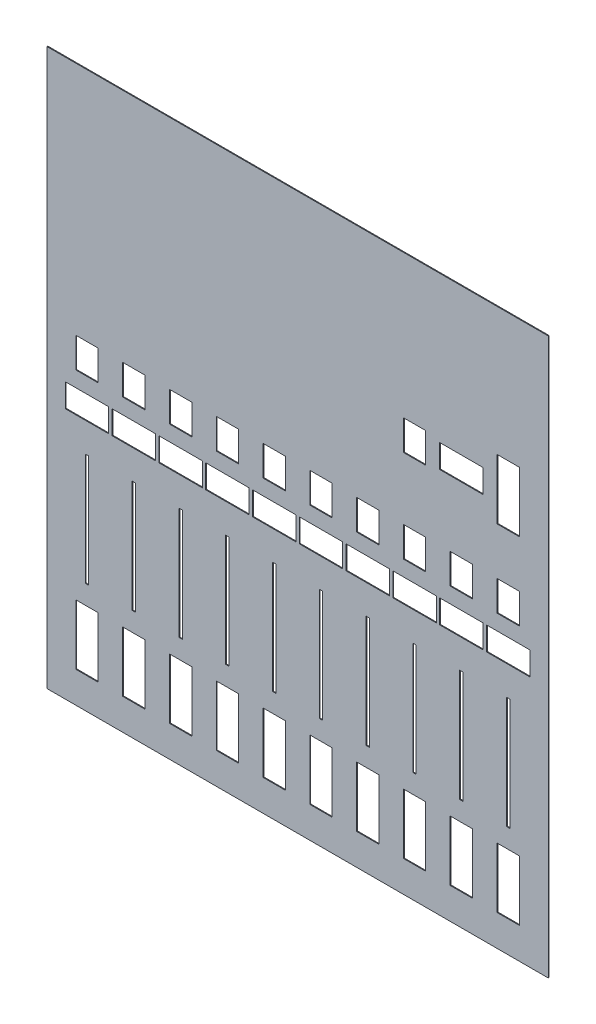
from build123d import *

# Parameters (mm, degrees)
SKETCH1_W           = 300
SKETCH1_H           = 210
SKETCH1_W_2         = 2
SKETCH1_H_2         = 67
SKETCH1_W_3         = 12.35
SKETCH1_H_3         = 17
SKETCH1_H_4         = 35
SKETCH1_W_4         = 25
SKETCH1_H_5         = 13
BOSS_EXTRUDE1_DEPTH = 0.5
SKETCH3_W           = 300
SKETCH3_H           = 66
SKETCH3_W_2         = 25
SKETCH3_H_2         = 13
SKETCH3_W_3         = 12.35
SKETCH3_H_3         = 35
BOSS_EXTRUDE2_DEPTH = 0.5
BOSS_EXTRUDE3_START = -300
BOSS_EXTRUDE3_DEPTH = 300
SKETCH13_W          = 12.35
SKETCH13_H          = 3.584384634
CUT_EXTRUDE4_DEPTH  = 15
SKETCH14_W          = 12.35
SKETCH14_H          = 17
CUT_EXTRUDE5_DEPTH  = 10
SKETCH15_W          = 12.35
SKETCH15_H          = 35
SKETCH15_W_2        = 13.35
SKETCH15_H_2        = 36
CUT_EXTRUDE6_DEPTH  = 10
SKETCH16_W          = 25
SKETCH16_H          = 13
CUT_EXTRUDE7_DEPTH  = 10
SKETCH17_W          = 12.35
SKETCH17_H          = 35
SKETCH17_H_2        = 17
CUT_EXTRUDE8_DEPTH  = 10
SKETCH18_W          = 13
SKETCH18_H          = 7
CUT_EXTRUDE9_DEPTH  = 10
SKETCH19_W          = 25
SKETCH19_H          = 1.257592029
BOSS_EXTRUDE7_DEPTH = 0.5
BOSS_EXTRUDE8_DEPTH = 0.5
SKETCH23_W          = 0.5
SKETCH23_H          = 56.7
BOSS_EXTRUDE9_DEPTH = 300
SKETCH24_W          = 145.58428362
SKETCH24_H          = 61.057685588
CUT_EXTRUDE11_DEPTH = 300


# Read off the part's stored shape, not the designer's step: Boss-Extrude3
with BuildPart() as part:
    # Sketch1 → Boss-Extrude1 (new body)
    with BuildSketch(Plane.XY):
        with Locations((140, 95)):
            Rectangle(SKETCH1_W, SKETCH1_H)
        with Locations((42, 89.5)):
            Rectangle(SKETCH1_W_2, SKETCH1_H_2, mode=Mode.SUBTRACT)
        with Locations((14.01, 172.725)):
            Rectangle(SKETCH1_W_3, SKETCH1_H_3, mode=Mode.SUBTRACT)
        with Locations((42.01, 172.725)):
            Rectangle(SKETCH1_W_3, SKETCH1_H_3, mode=Mode.SUBTRACT)
        with Locations((70.01, 172.725)):
            Rectangle(SKETCH1_W_3, SKETCH1_H_3, mode=Mode.SUBTRACT)
        with Locations((98.01, 172.725)):
            Rectangle(SKETCH1_W_3, SKETCH1_H_3, mode=Mode.SUBTRACT)
        with Locations((126.01, 172.725)):
            Rectangle(SKETCH1_W_3, SKETCH1_H_3, mode=Mode.SUBTRACT)
        with Locations((154.01, 172.725)):
            Rectangle(SKETCH1_W_3, SKETCH1_H_3, mode=Mode.SUBTRACT)
        with Locations((182.01, 172.725)):
            Rectangle(SKETCH1_W_3, SKETCH1_H_3, mode=Mode.SUBTRACT)
        with Locations((210.01, 172.725)):
            Rectangle(SKETCH1_W_3, SKETCH1_H_3, mode=Mode.SUBTRACT)
        with Locations((238.01, 172.725)):
            Rectangle(SKETCH1_W_3, SKETCH1_H_3, mode=Mode.SUBTRACT)
        with Locations((266.01, 172.725)):
            Rectangle(SKETCH1_W_3, SKETCH1_H_3, mode=Mode.SUBTRACT)
        with Locations((14.01, 26.625)):
            Rectangle(SKETCH1_W_3, SKETCH1_H_4, mode=Mode.SUBTRACT)
        with Locations((42.01, 26.625)):
            Rectangle(SKETCH1_W_3, SKETCH1_H_4, mode=Mode.SUBTRACT)
        with Locations((70.01, 26.625)):
            Rectangle(SKETCH1_W_3, SKETCH1_H_4, mode=Mode.SUBTRACT)
        with Locations((98.01, 26.625)):
            Rectangle(SKETCH1_W_3, SKETCH1_H_4, mode=Mode.SUBTRACT)
        with Locations((126.01, 26.625)):
            Rectangle(SKETCH1_W_3, SKETCH1_H_4, mode=Mode.SUBTRACT)
        with Locations((154.01, 26.625)):
            Rectangle(SKETCH1_W_3, SKETCH1_H_4, mode=Mode.SUBTRACT)
        with Locations((182.01, 26.625)):
            Rectangle(SKETCH1_W_3, SKETCH1_H_4, mode=Mode.SUBTRACT)
        with Locations((210.01, 26.625)):
            Rectangle(SKETCH1_W_3, SKETCH1_H_4, mode=Mode.SUBTRACT)
        with Locations((238.01, 26.625)):
            Rectangle(SKETCH1_W_3, SKETCH1_H_4, mode=Mode.SUBTRACT)
        with Locations((266.01, 26.625)):
            Rectangle(SKETCH1_W_3, SKETCH1_H_4, mode=Mode.SUBTRACT)
        with Locations((14, 89.5)):
            Rectangle(SKETCH1_W_2, SKETCH1_H_2, mode=Mode.SUBTRACT)
        with Locations((70, 89.5)):
            Rectangle(SKETCH1_W_2, SKETCH1_H_2, mode=Mode.SUBTRACT)
        with Locations((98, 89.5)):
            Rectangle(SKETCH1_W_2, SKETCH1_H_2, mode=Mode.SUBTRACT)
        with Locations((126, 89.5)):
            Rectangle(SKETCH1_W_2, SKETCH1_H_2, mode=Mode.SUBTRACT)
        with Locations((154, 89.5)):
            Rectangle(SKETCH1_W_2, SKETCH1_H_2, mode=Mode.SUBTRACT)
        with Locations((182, 89.5)):
            Rectangle(SKETCH1_W_2, SKETCH1_H_2, mode=Mode.SUBTRACT)
        with Locations((210, 89.5)):
            Rectangle(SKETCH1_W_2, SKETCH1_H_2, mode=Mode.SUBTRACT)
        with Locations((238, 89.5)):
            Rectangle(SKETCH1_W_2, SKETCH1_H_2, mode=Mode.SUBTRACT)
        with Locations((266, 89.5)):
            Rectangle(SKETCH1_W_2, SKETCH1_H_2, mode=Mode.SUBTRACT)
        with Locations((14, 147.5)):
            Rectangle(SKETCH1_W_4, SKETCH1_H_5, mode=Mode.SUBTRACT)
        with Locations((42, 147.5)):
            Rectangle(SKETCH1_W_4, SKETCH1_H_5, mode=Mode.SUBTRACT)
        with Locations((70, 147.5)):
            Rectangle(SKETCH1_W_4, SKETCH1_H_5, mode=Mode.SUBTRACT)
        with Locations((98, 147.5)):
            Rectangle(SKETCH1_W_4, SKETCH1_H_5, mode=Mode.SUBTRACT)
        with Locations((126, 147.5)):
            Rectangle(SKETCH1_W_4, SKETCH1_H_5, mode=Mode.SUBTRACT)
        with Locations((154, 147.5)):
            Rectangle(SKETCH1_W_4, SKETCH1_H_5, mode=Mode.SUBTRACT)
        with Locations((182, 147.5)):
            Rectangle(SKETCH1_W_4, SKETCH1_H_5, mode=Mode.SUBTRACT)
        with Locations((210, 147.5)):
            Rectangle(SKETCH1_W_4, SKETCH1_H_5, mode=Mode.SUBTRACT)
        with Locations((238, 147.5)):
            Rectangle(SKETCH1_W_4, SKETCH1_H_5, mode=Mode.SUBTRACT)
        with Locations((266, 147.5)):
            Rectangle(SKETCH1_W_4, SKETCH1_H_5, mode=Mode.SUBTRACT)
    extrude(amount=BOSS_EXTRUDE1_DEPTH)

    # Sketch3 → Boss-Extrude2 (add)
    with BuildSketch(Plane.XY.offset(0.5)):
        with Locations((140, 233)):
            Rectangle(SKETCH3_W, SKETCH3_H)
        with Locations((238, 229.85)):
            Rectangle(SKETCH3_W_2, SKETCH3_H_2, mode=Mode.SUBTRACT)
        with Locations((266, 228)):
            Rectangle(SKETCH3_W_3, SKETCH3_H_3, mode=Mode.SUBTRACT)
    extrude(amount=-BOSS_EXTRUDE2_DEPTH)

    # Boss-Extrude3 outline → Boss-Extrude3 (add)
    with BuildSketch(Plane(origin=(290, 0, 0), x_dir=(0, 0, -1), z_dir=(1, 0, 0)).offset(BOSS_EXTRUDE3_START)):
        with BuildLine():
            ThreePointArc((29.503906843, 296.000342244), (8.288157106, 287.214705752), (-0.5, 266))
            Line((-0.5, 266), (0, 266))
            ThreePointArc((0, 266), (8.331893478, 286.546702239), (28.621157433, 295.487238574))
            ThreePointArc((28.621157433, 295.487238574), (29.057049204, 295.497011647), (29.493037805, 295.500341552))
            ThreePointArc((29.493037805, 295.500341552), (29.496690131, 295.50034223), (29.500342456, 295.500342456))
            Line((29.500342456, 295.500342456), (29.501331505, 295.501324479))
            Line((29.501331505, 295.501324479), (29.752130896, 295.75034235))
            Line((29.752130896, 295.75034235), (29.503906843, 296.000342244))
        make_face()
        with BuildLine():
            ThreePointArc((29.855162644, 295.852642226), (29.694156025, 295.961264134), (29.503906843, 296.000342244))
            Line((29.503906843, 296.000342244), (29.752130896, 295.75034235))
            Line((29.752130896, 295.75034235), (29.855162644, 295.852642226))
        make_face()
        with BuildLine():
            ThreePointArc((29.912937624, 295.910006809), (29.713187706, 295.976752163), (29.503906843, 296.000342244))
            ThreePointArc((29.503906843, 296.000342244), (29.694156025, 295.961264134), (29.855162644, 295.852642226))
            Line((29.855162644, 295.852642226), (29.912937624, 295.910006809))
        make_face()
        with BuildLine():
            Line((29.855162644, 295.852642226), (29.752130896, 295.75034235))
            Line((29.752130896, 295.75034235), (30.000354949, 295.500342456))
            Line((30.000354949, 295.500342456), (29.528548786, 295.500342456))
            ThreePointArc((29.528548786, 295.500342456), (29.704451076, 295.456616738), (29.853553391, 295.353553391))
            ThreePointArc((29.853553391, 295.353553391), (29.962914912, 295.270927945), (30.090809748, 295.221634764))
            Line((30.090809748, 295.221634764), (30.474848123, 295.221634764))
            ThreePointArc((30.474848123, 295.221634764), (30.376441658, 295.479857265), (30.211342813, 295.701453887))
            Line((30.211342813, 295.701453887), (30.202294762, 295.701453887))
            ThreePointArc((30.202294762, 295.701453887), (30.013864766, 295.742920094), (29.855162644, 295.852642226))
        make_face()
        with BuildLine():
            Line((30.000354949, 295.500342456), (29.752130896, 295.75034235))
            Line((29.752130896, 295.75034235), (29.501331505, 295.501324479))
            ThreePointArc((29.501331505, 295.501324479), (29.514946772, 295.50101713), (29.528548786, 295.500342456))
            Line((29.528548786, 295.500342456), (30.000354949, 295.500342456))
        make_face()
        with BuildLine():
            Line((29.912937624, 295.910006809), (29.855162644, 295.852642226))
            ThreePointArc((29.855162644, 295.852642226), (30.013864766, 295.742920094), (30.202294762, 295.701453887))
            Line((30.202294762, 295.701453887), (30.211342813, 295.701453887))
            ThreePointArc((30.211342813, 295.701453887), (30.071675845, 295.819374273), (29.912937624, 295.910006809))
        make_face()
        with BuildLine():
            ThreePointArc((30.500367442, 294.996752781), (30.366426547, 294.495843598), (30.000354949, 294.128635538))
            Line((30.000354949, 294.128635538), (30.000354949, 285))
            Line((30.000354949, 285), (30.500367442, 285))
            Line((30.500367442, 285), (30.500367442, 294.996752781))
        make_face()
        with BuildLine():
            Line((30.000354949, 294.996752781), (30.000354949, 294.128635538))
            ThreePointArc((30.000354949, 294.128635538), (30.366426547, 294.495843598), (30.500367442, 294.996752781))
            ThreePointArc((30.500367442, 294.996752781), (30.493967204, 295.109915432), (30.474848123, 295.221634764))
            Line((30.474848123, 295.221634764), (30.090809748, 295.221634764))
            ThreePointArc((30.090809748, 295.221634764), (29.962914912, 295.270927945), (29.853553391, 295.353553391))
            ThreePointArc((29.853553391, 295.353553391), (29.704451076, 295.456616738), (29.528548786, 295.500342456))
            Line((29.528548786, 295.500342456), (29.500342456, 295.500342456))
            ThreePointArc((29.500342456, 295.500342456), (29.514421337, 295.500045201), (29.528486402, 295.499354419))
            ThreePointArc((29.528486402, 295.499354419), (29.863901447, 295.341451321), (30.000354949, 294.996752781))
        make_face()
    extrude(amount=BOSS_EXTRUDE3_DEPTH)

    # Sketch13 → Cut-Extrude4 (cut)
    with BuildSketch(Plane.XY.offset(0.5)):
        Polygon((216.175, 232.915615366), (203.825, 232.915615366), (203.825, 219.5), (216.175, 219.5), (216.175, 228), align=None)
        with Locations((210, 234.707807683)):
            Rectangle(SKETCH13_W, SKETCH13_H)
    extrude(amount=-CUT_EXTRUDE4_DEPTH, mode=Mode.SUBTRACT)

    # Sketch14 → Cut-Extrude5 (cut)
    # profile 1 of 10: a face of its own
    with BuildSketch(Plane.XY.offset(0.5)):
        Polygon((20.685, 181.725), (7.835, 181.725), (7.335, 181.725), (7.335, 163.725), (20.685, 163.725), align=None)
        with Locations((14.01, 172.725)):
            Rectangle(SKETCH14_W, SKETCH14_H, mode=Mode.SUBTRACT)
    # profile 2 of 10: a face of its own
    with BuildSketch(Plane.XY.offset(0.5)):
        Polygon((48.685, 181.725), (35.835, 181.725), (35.335, 181.725), (35.335, 163.725), (48.685, 163.725), align=None)
        with Locations((42.01, 172.725)):
            Rectangle(SKETCH14_W, SKETCH14_H, mode=Mode.SUBTRACT)
    # profile 3 of 10: a face of its own
    with BuildSketch(Plane.XY.offset(0.5)):
        Polygon((76.685, 181.725), (63.835, 181.725), (63.335, 181.725), (63.335, 163.725), (76.685, 163.725), align=None)
        with Locations((70.01, 172.725)):
            Rectangle(SKETCH14_W, SKETCH14_H, mode=Mode.SUBTRACT)
    # profile 4 of 10: a face of its own
    with BuildSketch(Plane.XY.offset(0.5)):
        Polygon((104.685, 181.725), (91.835, 181.725), (91.335, 181.725), (91.335, 163.725), (104.685, 163.725), align=None)
        with Locations((98.01, 172.725)):
            Rectangle(SKETCH14_W, SKETCH14_H, mode=Mode.SUBTRACT)
    # profile 5 of 10: a face of its own
    with BuildSketch(Plane.XY.offset(0.5)):
        Polygon((132.685, 181.725), (119.835, 181.725), (119.335, 181.725), (119.335, 163.725), (132.685, 163.725), align=None)
        with Locations((126.01, 172.725)):
            Rectangle(SKETCH14_W, SKETCH14_H, mode=Mode.SUBTRACT)
    # profile 6 of 10: a face of its own
    with BuildSketch(Plane.XY.offset(0.5)):
        Polygon((160.685, 181.725), (147.835, 181.725), (147.335, 181.725), (147.335, 163.725), (160.685, 163.725), align=None)
        with Locations((154.01, 172.725)):
            Rectangle(SKETCH14_W, SKETCH14_H, mode=Mode.SUBTRACT)
    # profile 7 of 10: a face of its own
    with BuildSketch(Plane.XY.offset(0.5)):
        Polygon((188.685, 181.725), (175.835, 181.725), (175.335, 181.725), (175.335, 163.725), (188.685, 163.725), align=None)
        with Locations((182.01, 172.725)):
            Rectangle(SKETCH14_W, SKETCH14_H, mode=Mode.SUBTRACT)
    # profile 8 of 10: a face of its own
    with BuildSketch(Plane.XY.offset(0.5)):
        Polygon((216.685, 181.725), (203.835, 181.725), (203.335, 181.725), (203.335, 163.725), (216.685, 163.725), align=None)
        with Locations((210.01, 172.725)):
            Rectangle(SKETCH14_W, SKETCH14_H, mode=Mode.SUBTRACT)
    # profile 9 of 10: a face of its own
    with BuildSketch(Plane.XY.offset(0.5)):
        Polygon((244.685, 181.725), (231.835, 181.725), (231.335, 181.725), (231.335, 163.725), (244.685, 163.725), align=None)
        with Locations((238.01, 172.725)):
            Rectangle(SKETCH14_W, SKETCH14_H, mode=Mode.SUBTRACT)
    # profile 10 of 10: a face of its own
    with BuildSketch(Plane.XY.offset(0.5)):
        Polygon((272.685, 181.725), (259.835, 181.725), (259.335, 181.725), (259.335, 163.725), (272.685, 163.725), align=None)
        with Locations((266.01, 172.725)):
            Rectangle(SKETCH14_W, SKETCH14_H, mode=Mode.SUBTRACT)
    extrude(amount=-CUT_EXTRUDE5_DEPTH, mode=Mode.SUBTRACT)

    # Sketch15 → Cut-Extrude6 (cut)
    # profile 1 of 10: a face of its own
    with BuildSketch(Plane.XY.offset(0.5)):
        Polygon((20.685, 44.625), (7.835, 44.625), (7.335, 44.625), (7.335, 8.625), (20.685, 8.625), align=None)
        with Locations((14.01, 26.625)):
            Rectangle(SKETCH15_W, SKETCH15_H, mode=Mode.SUBTRACT)
    # profile 2 of 10: a face of its own
    with BuildSketch(Plane.XY.offset(0.5)):
        with Locations((42.01, 26.625)):
            Rectangle(SKETCH15_W_2, SKETCH15_H_2)
        with Locations((42.01, 26.625)):
            Rectangle(SKETCH15_W, SKETCH15_H, mode=Mode.SUBTRACT)
    # profile 3 of 10: a face of its own
    with BuildSketch(Plane.XY.offset(0.5)):
        with Locations((70.01, 26.625)):
            Rectangle(SKETCH15_W_2, SKETCH15_H_2)
        with Locations((70.01, 26.625)):
            Rectangle(SKETCH15_W, SKETCH15_H, mode=Mode.SUBTRACT)
    # profile 4 of 10: a face of its own
    with BuildSketch(Plane.XY.offset(0.5)):
        with Locations((98.01, 26.625)):
            Rectangle(SKETCH15_W_2, SKETCH15_H_2)
        with Locations((98.01, 26.625)):
            Rectangle(SKETCH15_W, SKETCH15_H, mode=Mode.SUBTRACT)
    # profile 5 of 10: a face of its own
    with BuildSketch(Plane.XY.offset(0.5)):
        with Locations((126.01, 26.625)):
            Rectangle(SKETCH15_W_2, SKETCH15_H_2)
        with Locations((126.01, 26.625)):
            Rectangle(SKETCH15_W, SKETCH15_H, mode=Mode.SUBTRACT)
    # profile 6 of 10: a face of its own
    with BuildSketch(Plane.XY.offset(0.5)):
        with Locations((154.01, 26.625)):
            Rectangle(SKETCH15_W_2, SKETCH15_H_2)
        with Locations((154.01, 26.625)):
            Rectangle(SKETCH15_W, SKETCH15_H, mode=Mode.SUBTRACT)
    # profile 7 of 10: a face of its own
    with BuildSketch(Plane.XY.offset(0.5)):
        with Locations((182.01, 26.625)):
            Rectangle(SKETCH15_W_2, SKETCH15_H_2)
        with Locations((182.01, 26.625)):
            Rectangle(SKETCH15_W, SKETCH15_H, mode=Mode.SUBTRACT)
    # profile 8 of 10: a face of its own
    with BuildSketch(Plane.XY.offset(0.5)):
        with Locations((210.01, 26.625)):
            Rectangle(SKETCH15_W_2, SKETCH15_H_2)
        with Locations((210.01, 26.625)):
            Rectangle(SKETCH15_W, SKETCH15_H, mode=Mode.SUBTRACT)
    # profile 9 of 10: a face of its own
    with BuildSketch(Plane.XY.offset(0.5)):
        with Locations((238.01, 26.625)):
            Rectangle(SKETCH15_W_2, SKETCH15_H_2)
        with Locations((238.01, 26.625)):
            Rectangle(SKETCH15_W, SKETCH15_H, mode=Mode.SUBTRACT)
    # profile 10 of 10: a face of its own
    with BuildSketch(Plane.XY.offset(0.5)):
        with Locations((266.01, 26.625)):
            Rectangle(SKETCH15_W_2, SKETCH15_H_2)
        with Locations((266.01, 26.625)):
            Rectangle(SKETCH15_W, SKETCH15_H, mode=Mode.SUBTRACT)
    extrude(amount=-CUT_EXTRUDE6_DEPTH, mode=Mode.SUBTRACT)

    # Sketch16 → Cut-Extrude7 (cut)
    # profile 1 of 10: a face of its own
    with BuildSketch(Plane.XY.offset(0.5)):
        Polygon((27, 154.5), (1.5, 154.5), (1, 154.5), (1, 140.5), (27, 140.5), align=None)
        with Locations((14, 147.5)):
            Rectangle(SKETCH16_W, SKETCH16_H, mode=Mode.SUBTRACT)
    # profile 2 of 10: a face of its own
    with BuildSketch(Plane.XY.offset(0.5)):
        Polygon((55, 154.5), (29.5, 154.5), (29, 154.5), (29, 140.5), (55, 140.5), align=None)
        with Locations((42, 147.5)):
            Rectangle(SKETCH16_W, SKETCH16_H, mode=Mode.SUBTRACT)
    # profile 3 of 10: a face of its own
    with BuildSketch(Plane.XY.offset(0.5)):
        Polygon((83, 154.5), (57.5, 154.5), (57, 154.5), (57, 140.5), (83, 140.5), align=None)
        with Locations((70, 147.5)):
            Rectangle(SKETCH16_W, SKETCH16_H, mode=Mode.SUBTRACT)
    # profile 4 of 10: a face of its own
    with BuildSketch(Plane.XY.offset(0.5)):
        Polygon((111, 154.5), (85.5, 154.5), (85, 154.5), (85, 140.5), (111, 140.5), align=None)
        with Locations((98, 147.5)):
            Rectangle(SKETCH16_W, SKETCH16_H, mode=Mode.SUBTRACT)
    # profile 5 of 10: a face of its own
    with BuildSketch(Plane.XY.offset(0.5)):
        Polygon((139, 154.5), (113.5, 154.5), (113, 154.5), (113, 140.5), (139, 140.5), align=None)
        with Locations((126, 147.5)):
            Rectangle(SKETCH16_W, SKETCH16_H, mode=Mode.SUBTRACT)
    # profile 6 of 10: a face of its own
    with BuildSketch(Plane.XY.offset(0.5)):
        Polygon((167, 154.5), (141.5, 154.5), (141, 154.5), (141, 140.5), (167, 140.5), align=None)
        with Locations((154, 147.5)):
            Rectangle(SKETCH16_W, SKETCH16_H, mode=Mode.SUBTRACT)
    # profile 7 of 10: a face of its own
    with BuildSketch(Plane.XY.offset(0.5)):
        Polygon((195, 154.5), (169.5, 154.5), (169, 154.5), (169, 140.5), (195, 140.5), align=None)
        with Locations((182, 147.5)):
            Rectangle(SKETCH16_W, SKETCH16_H, mode=Mode.SUBTRACT)
    # profile 8 of 10: a face of its own
    with BuildSketch(Plane.XY.offset(0.5)):
        Polygon((223, 154.5), (197.5, 154.5), (197, 154.5), (197, 140.5), (223, 140.5), align=None)
        with Locations((210, 147.5)):
            Rectangle(SKETCH16_W, SKETCH16_H, mode=Mode.SUBTRACT)
    # profile 9 of 10: a face of its own
    with BuildSketch(Plane.XY.offset(0.5)):
        Polygon((251, 154.5), (225.5, 154.5), (225, 154.5), (225, 140.5), (251, 140.5), align=None)
        with Locations((238, 147.5)):
            Rectangle(SKETCH16_W, SKETCH16_H, mode=Mode.SUBTRACT)
    # profile 10 of 10: a face of its own
    with BuildSketch(Plane.XY.offset(0.5)):
        Polygon((279, 154.5), (253.5, 154.5), (253, 154.5), (253, 140.5), (279, 140.5), align=None)
        with Locations((266, 147.5)):
            Rectangle(SKETCH16_W, SKETCH16_H, mode=Mode.SUBTRACT)
    extrude(amount=-CUT_EXTRUDE7_DEPTH, mode=Mode.SUBTRACT)

    # Sketch17 → Cut-Extrude8 (cut)
    # profile 1 of 2: a face of its own
    with BuildSketch(Plane.XY.offset(0.5)):
        Polygon((272.675, 246), (259.825, 246), (259.325, 246), (259.325, 210), (272.675, 210), align=None)
        with Locations((266, 228)):
            Rectangle(SKETCH17_W, SKETCH17_H, mode=Mode.SUBTRACT)
    # profile 2 of 2: a face of its own
    with BuildSketch(Plane.XY.offset(0.5)):
        Polygon((216.675, 237), (203.825, 237), (203.325, 237), (203.325, 219), (216.675, 219), align=None)
        with Locations((210, 228)):
            Rectangle(SKETCH17_W, SKETCH17_H_2, mode=Mode.SUBTRACT)
    extrude(amount=-CUT_EXTRUDE8_DEPTH, mode=Mode.SUBTRACT)

    # Sketch18 → Cut-Extrude9 (cut)
    with BuildSketch(Plane.XY.offset(0.5)):
        Polygon((225, 235), (225, 228), (238, 228), (250.5, 228), (251, 228), (251, 235), align=None)
        with Locations((231.5, 224.5)):
            Rectangle(SKETCH18_W, SKETCH18_H)
        Polygon((238, 223.35), (238, 221), (251, 221), (251, 228), (250.5, 228), (250.5, 223.35), align=None)
    extrude(amount=-CUT_EXTRUDE9_DEPTH, mode=Mode.SUBTRACT)

    # Sketch19 → Boss-Extrude7 (add)
    with BuildSketch(Plane.XY.offset(0.5)):
        with Locations((238, 235.628796015)):
            Rectangle(SKETCH19_W, SKETCH19_H)
    extrude(amount=-BOSS_EXTRUDE7_DEPTH)

    # Sketch20 → Boss-Extrude8 (add)
    with BuildSketch(Plane.XY.offset(0.5)):
        Polygon((224.437375883, 237.361007254), (251.612410637, 237.668818311), (251.632752312, 235.872957809), (224.457717557, 235.565146752), align=None)
    extrude(amount=-BOSS_EXTRUDE8_DEPTH)

    # Sketch23 → Boss-Extrude9 (add)
    with BuildSketch(Plane(origin=(290, 0, 0), x_dir=(0, 0, -1), z_dir=(1, 0, 0))):
        with Locations((-0.25, 294.35)):
            Rectangle(SKETCH23_W, SKETCH23_H)
    extrude(amount=-BOSS_EXTRUDE9_DEPTH)

    # Sketch24 → Cut-Extrude11 (cut)
    with BuildSketch(Plane.ZY.offset(10)):
        with Locations((-72.79214181, 292.171157206)):
            Rectangle(SKETCH24_W, SKETCH24_H)
    extrude(amount=-CUT_EXTRUDE11_DEPTH, mode=Mode.SUBTRACT)


solid = part.part
